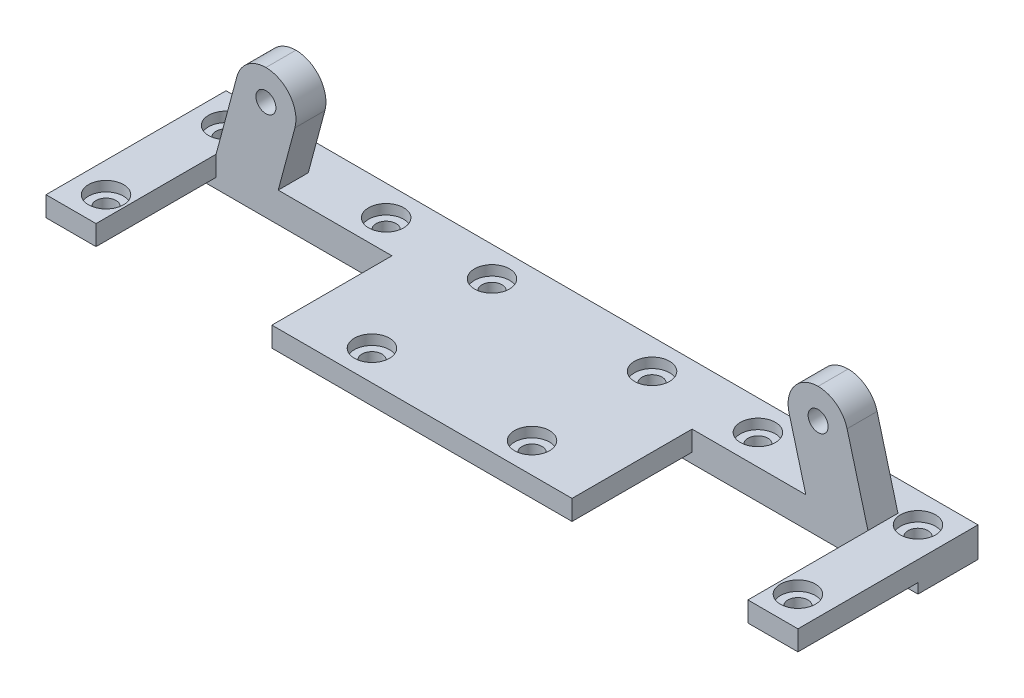
from build123d import *

# Parameters (mm, degrees)
SKETCH_1_R           = 0.75
EXTRUDE_1_DEPTH      = 6
SKETCH_2_R           = 1
CUT_EXTRUDE_1_DEPTH  = 1.5
SKETCH_3_W           = 75.160479418
SKETCH_3_H           = 12
EXTRUDE_2_DEPTH      = 3
SKETCH_4_R           = 0.75
CUT_EXTRUDE_2_DEPTH  = 3
SKETCH_5_W           = 5
SKETCH_5_H           = 12
SKETCH_5_W_2         = 30
CUT_EXTRUDE_3_DEPTH  = 2
SKETCH_6_OUTSIDE_W   = 104.908
SKETCH_6_OUTSIDE_H   = 145.748
SKETCH_6_OUTSIDE_W_2 = 75.160479418
SKETCH_6_OUTSIDE_H_2 = 13
CUT_EXTRUDE_4_DEPTH  = 120.23621269
SKETCH_7_W           = 9
SKETCH_7_H           = 13
CUT_EXTRUDE_5_DEPTH  = 136.845859953
SKETCH_8_R           = 1
CUT_EXTRUDE_6_DEPTH  = 120.122938247
SKETCH_8_3_R         = 1.75
SKETCH_8_3_R_2       = 1
CUT_EXTRUDE_7_DEPTH  = 1.5
SKETCH_9_W           = 5
SKETCH_9_H           = 15
SKETCH_9_W_2         = 30
EXTRUDE_3_DEPTH      = 2
SKETCH_10_W          = 75.160479418
SKETCH_10_H          = 3
EXTRUDE_4_DEPTH      = 3
SKETCH_11_R          = 1
CUT_EXTRUDE_8_DEPTH  = 43.851772619
SKETCH_11_3_R        = 1.75
SKETCH_11_3_R_2      = 1
CUT_EXTRUDE_9_DEPTH  = 1
FILLET_1_R           = 3


with BuildPart() as part:
    # 草图1 → 凸台-拉伸1 (new body)
    with BuildSketch(Plane.XY):
        with BuildLine():
            Line((0, -11.591109915), (26.368582626, -110))
            Line((26.368582626, -110), (32.580239709, -110))
            Line((32.580239709, -110), (2.897777479, 0.776457135))
            ThreePointArc((2.897777479, 0.776457135), (0, 3), (-2.897777479, 0.776457135))
            Line((-2.897777479, 0.776457135), (-32.580239709, -110))
            Line((-32.580239709, -110), (-26.368582626, -110))
            Line((-26.368582626, -110), (0, -11.591109915))
        make_face()
        with Locations((13.665408814, -51)):
            Circle(SKETCH_1_R, mode=Mode.SUBTRACT)
        Circle(SKETCH_1_R, mode=Mode.SUBTRACT)
        with Locations((-13.665408814, -51)):
            Circle(SKETCH_1_R, mode=Mode.SUBTRACT)
    extrude(amount=EXTRUDE_1_DEPTH)

    # 草图2 → 切除-拉伸1 (cut)
    with BuildSketch(Plane(origin=(0, 0, 0), x_dir=(-1, 0, 0), z_dir=(0, 0, -1))):
        Circle(SKETCH_2_R)
        with Locations((13.665408814, -51)):
            Circle(SKETCH_2_R)
        with Locations((-13.665408814, -51)):
            Circle(SKETCH_2_R)
    extrude(amount=-CUT_EXTRUDE_1_DEPTH, mode=Mode.SUBTRACT)

    # 草图3 → 凸台-拉伸2 (add)
    with BuildSketch(Plane.XZ.offset(110)):
        Rectangle(SKETCH_3_W, SKETCH_3_H)
    extrude(amount=EXTRUDE_2_DEPTH)

    # 草图4 → 切除-拉伸2 (cut)
    with BuildSketch(Plane.XY.offset(6)):
        with Locations((-27.59876682, -103)):
            Circle(SKETCH_4_R)
        with Locations((27.59876682, -103)):
            Circle(SKETCH_4_R)
    extrude(amount=-CUT_EXTRUDE_2_DEPTH, mode=Mode.SUBTRACT)

    # 草图5 → 切除-拉伸3 (cut)
    with BuildSketch(Plane(origin=(0, -110, 0), x_dir=(1, 0, 0), z_dir=(0, 1, 0))):
        with Locations((-35.080239709, 0)):
            Rectangle(SKETCH_5_W, SKETCH_5_H)
        with Locations((35.080239709, 0)):
            Rectangle(SKETCH_5_W, SKETCH_5_H)
        Rectangle(SKETCH_5_W_2, SKETCH_5_H)
    extrude(amount=-CUT_EXTRUDE_3_DEPTH, mode=Mode.SUBTRACT)

    # 草图6 outside → 切除-拉伸4 (cut, through all)
    with BuildSketch(Plane(origin=(0, 0, 0), x_dir=(-1, 0, 0), z_dir=(0, 0, -1))):
        with Locations((0, -55)):
            Rectangle(SKETCH_6_OUTSIDE_W, SKETCH_6_OUTSIDE_H)
        with Locations((0, -106.5)):
            Rectangle(SKETCH_6_OUTSIDE_W_2, SKETCH_6_OUTSIDE_H_2, mode=Mode.SUBTRACT)
    extrude(amount=-CUT_EXTRUDE_4_DEPTH, mode=Mode.SUBTRACT)

    # 草图7 → 切除-拉伸5 (cut, through all)
    with BuildSketch(Plane(origin=(37.580239709, 0, 0), x_dir=(0, 0, -1), z_dir=(1, 0, 0))):
        with Locations((1.5, -106.5)):
            Rectangle(SKETCH_7_W, SKETCH_7_H)
    extrude(amount=-CUT_EXTRUDE_5_DEPTH, mode=Mode.SUBTRACT)

    # 草图8 → 切除-拉伸6 (cut, through all)
    with BuildSketch(Plane(origin=(0, 0, 3), x_dir=(-1, 0, 0), z_dir=(0, 0, -1))):
        with Locations(Location((-27.59876682, -103, 0), (0, 0, 90))):
            Circle(SKETCH_8_R)
        with Locations(Location((27.59876682, -103, 0), (0, 0, 90))):
            Circle(SKETCH_8_R)
    extrude(amount=-CUT_EXTRUDE_6_DEPTH, mode=Mode.SUBTRACT)

    # 草图8<3> → 切除-拉伸7 (cut)
    # profile 1 of 2: a face of its own
    with BuildSketch(Plane(origin=(0, 0, 3), x_dir=(-1, 0, 0), z_dir=(0, 0, -1))):
        with Locations(Location((-27.59876682, -103, 0), (0, 0, 90))):
            Circle(SKETCH_8_3_R)
        with Locations(Location((-27.59876682, -103, 0), (0, 0, 90))):
            Circle(SKETCH_8_3_R_2, mode=Mode.SUBTRACT)
    # profile 2 of 2: a face of its own
    with BuildSketch(Plane(origin=(0, 0, 3), x_dir=(-1, 0, 0), z_dir=(0, 0, -1))):
        with Locations(Location((27.59876682, -103, 0), (0, 0, 90))):
            Circle(SKETCH_8_3_R)
        with Locations(Location((27.59876682, -103, 0), (0, 0, 90))):
            Circle(SKETCH_8_3_R_2, mode=Mode.SUBTRACT)
    extrude(amount=-CUT_EXTRUDE_7_DEPTH, mode=Mode.SUBTRACT)

    # 草图9 → 凸台-拉伸3 (add)
    with BuildSketch(Plane(origin=(0, -112, 0), x_dir=(1, 0, 0), z_dir=(0, 1, 0))):
        with Locations((35.080239709, -10.5)):
            Rectangle(SKETCH_9_W, SKETCH_9_H)
        with Locations((0, -10.5)):
            Rectangle(SKETCH_9_W_2, SKETCH_9_H)
        with Locations((-35.080239709, -10.5)):
            Rectangle(SKETCH_9_W, SKETCH_9_H)
    extrude(amount=EXTRUDE_3_DEPTH)

    # 草图10 → 凸台-拉伸4 (add)
    with BuildSketch(Plane(origin=(0, 0, 3), x_dir=(-1, 0, 0), z_dir=(0, 0, -1))):
        with Locations((0, -111.5)):
            Rectangle(SKETCH_10_W, SKETCH_10_H)
    extrude(amount=EXTRUDE_4_DEPTH)

    # 草图11 → 切除-拉伸8 (cut, through all)
    with BuildSketch(Plane(origin=(0, -110, 0), x_dir=(1, 0, 0), z_dir=(0, 1, 0))):
        with Locations(Location((34.580239709, -15, 0), (0, 0, 270))):
            Circle(SKETCH_11_R)
        with Locations(Location((34.580239709, -3, 0), (0, 0, 270))):
            Circle(SKETCH_11_R)
        with Locations(Location((-18.580239709, -3, 0), (0, 0, 270))):
            Circle(SKETCH_11_R)
        with Locations(Location((18.580239709, -3, 0), (0, 0, 270))):
            Circle(SKETCH_11_R)
        with Locations(Location((-34.580239709, -3, 0), (0, 0, 270))):
            Circle(SKETCH_11_R)
        with Locations(Location((-34.580239709, -15, 0), (0, 0, 270))):
            Circle(SKETCH_11_R)
        with Locations((18.580239709, -15)):
            Circle(SKETCH_11_R)
        with Locations((-18.580239709, -15)):
            Circle(SKETCH_11_R)
        with Locations(Location((-8, -3, 0), (0, 0, 270))):
            Circle(SKETCH_11_R)
        with Locations(Location((8, -3, 0), (0, 0, 270))):
            Circle(SKETCH_11_R)
        with Locations(Location((-8, -15, 0), (0, 0, 270))):
            Circle(SKETCH_11_R)
        with Locations(Location((8, -15, 0), (0, 0, 270))):
            Circle(SKETCH_11_R)
    extrude(amount=-CUT_EXTRUDE_8_DEPTH, mode=Mode.SUBTRACT)

    # 草图11<3> → 切除-拉伸9 (cut)
    # profile 1 of 12: a face of its own
    with BuildSketch(Plane(origin=(0, -110, 0), x_dir=(1, 0, 0), z_dir=(0, 1, 0))):
        with Locations(Location((34.580239709, -15, 0), (0, 0, 270))):
            Circle(SKETCH_11_3_R)
        with Locations(Location((34.580239709, -15, 0), (0, 0, 270))):
            Circle(SKETCH_11_3_R_2, mode=Mode.SUBTRACT)
    # profile 2 of 12: a face of its own
    with BuildSketch(Plane(origin=(0, -110, 0), x_dir=(1, 0, 0), z_dir=(0, 1, 0))):
        with Locations(Location((34.580239709, -3, 0), (0, 0, 270))):
            Circle(SKETCH_11_3_R)
        with Locations(Location((34.580239709, -3, 0), (0, 0, 270))):
            Circle(SKETCH_11_3_R_2, mode=Mode.SUBTRACT)
    # profile 3 of 12: a face of its own
    with BuildSketch(Plane(origin=(0, -110, 0), x_dir=(1, 0, 0), z_dir=(0, 1, 0))):
        with Locations(Location((18.580239709, -3, 0), (0, 0, 270))):
            Circle(SKETCH_11_3_R)
        with Locations(Location((18.580239709, -3, 0), (0, 0, 270))):
            Circle(SKETCH_11_3_R_2, mode=Mode.SUBTRACT)
    # profile 4 of 12: a face of its own
    with BuildSketch(Plane(origin=(0, -110, 0), x_dir=(1, 0, 0), z_dir=(0, 1, 0))):
        with Locations(Location((-18.580239709, -3, 0), (0, 0, 270))):
            Circle(SKETCH_11_3_R)
        with Locations(Location((-18.580239709, -3, 0), (0, 0, 270))):
            Circle(SKETCH_11_3_R_2, mode=Mode.SUBTRACT)
    # profile 5 of 12: a face of its own
    with BuildSketch(Plane(origin=(0, -110, 0), x_dir=(1, 0, 0), z_dir=(0, 1, 0))):
        with Locations(Location((-34.580239709, -3, 0), (0, 0, 270))):
            Circle(SKETCH_11_3_R)
        with Locations(Location((-34.580239709, -3, 0), (0, 0, 270))):
            Circle(SKETCH_11_3_R_2, mode=Mode.SUBTRACT)
    # profile 6 of 12: a face of its own
    with BuildSketch(Plane(origin=(0, -110, 0), x_dir=(1, 0, 0), z_dir=(0, 1, 0))):
        with Locations(Location((-34.580239709, -15, 0), (0, 0, 270))):
            Circle(SKETCH_11_3_R)
        with Locations(Location((-34.580239709, -15, 0), (0, 0, 270))):
            Circle(SKETCH_11_3_R_2, mode=Mode.SUBTRACT)
    # profile 7 of 12: a face of its own
    with BuildSketch(Plane(origin=(0, -110, 0), x_dir=(1, 0, 0), z_dir=(0, 1, 0))):
        with Locations((18.580239709, -15)):
            Circle(SKETCH_11_3_R)
        with Locations((18.580239709, -15)):
            Circle(SKETCH_11_3_R_2, mode=Mode.SUBTRACT)
    # profile 8 of 12: a face of its own
    with BuildSketch(Plane(origin=(0, -110, 0), x_dir=(1, 0, 0), z_dir=(0, 1, 0))):
        with Locations((-18.580239709, -15)):
            Circle(SKETCH_11_3_R)
        with Locations((-18.580239709, -15)):
            Circle(SKETCH_11_3_R_2, mode=Mode.SUBTRACT)
    # profile 9 of 12: a face of its own
    with BuildSketch(Plane(origin=(0, -110, 0), x_dir=(1, 0, 0), z_dir=(0, 1, 0))):
        with Locations(Location((-8, -3, 0), (0, 0, 270))):
            Circle(SKETCH_11_3_R)
        with Locations(Location((-8, -3, 0), (0, 0, 270))):
            Circle(SKETCH_11_3_R_2, mode=Mode.SUBTRACT)
    # profile 10 of 12: a face of its own
    with BuildSketch(Plane(origin=(0, -110, 0), x_dir=(1, 0, 0), z_dir=(0, 1, 0))):
        with Locations(Location((8, -3, 0), (0, 0, 270))):
            Circle(SKETCH_11_3_R)
        with Locations(Location((8, -3, 0), (0, 0, 270))):
            Circle(SKETCH_11_3_R_2, mode=Mode.SUBTRACT)
    # profile 11 of 12: a face of its own
    with BuildSketch(Plane(origin=(0, -110, 0), x_dir=(1, 0, 0), z_dir=(0, 1, 0))):
        with Locations(Location((-8, -15, 0), (0, 0, 270))):
            Circle(SKETCH_11_3_R)
        with Locations(Location((-8, -15, 0), (0, 0, 270))):
            Circle(SKETCH_11_3_R_2, mode=Mode.SUBTRACT)
    # profile 12 of 12: a face of its own
    with BuildSketch(Plane(origin=(0, -110, 0), x_dir=(1, 0, 0), z_dir=(0, 1, 0))):
        with Locations(Location((8, -15, 0), (0, 0, 270))):
            Circle(SKETCH_11_3_R)
        with Locations(Location((8, -15, 0), (0, 0, 270))):
            Circle(SKETCH_11_3_R_2, mode=Mode.SUBTRACT)
    extrude(amount=-CUT_EXTRUDE_9_DEPTH, mode=Mode.SUBTRACT)

    # 圆角1
    fillet_1_edges = [part.edges().sort_by_distance(p)[0] for p in [
        (-29.900747784, -100, 4.5),
        (-23.689090702, -100, 4.5),
        (23.689090702, -100, 4.5),
        (29.900747784, -100, 4.5),
    ]]
    fillet(fillet_1_edges, radius=FILLET_1_R - 0.0001)  # a hair under: the kernel refuses the full size


solid = part.part
